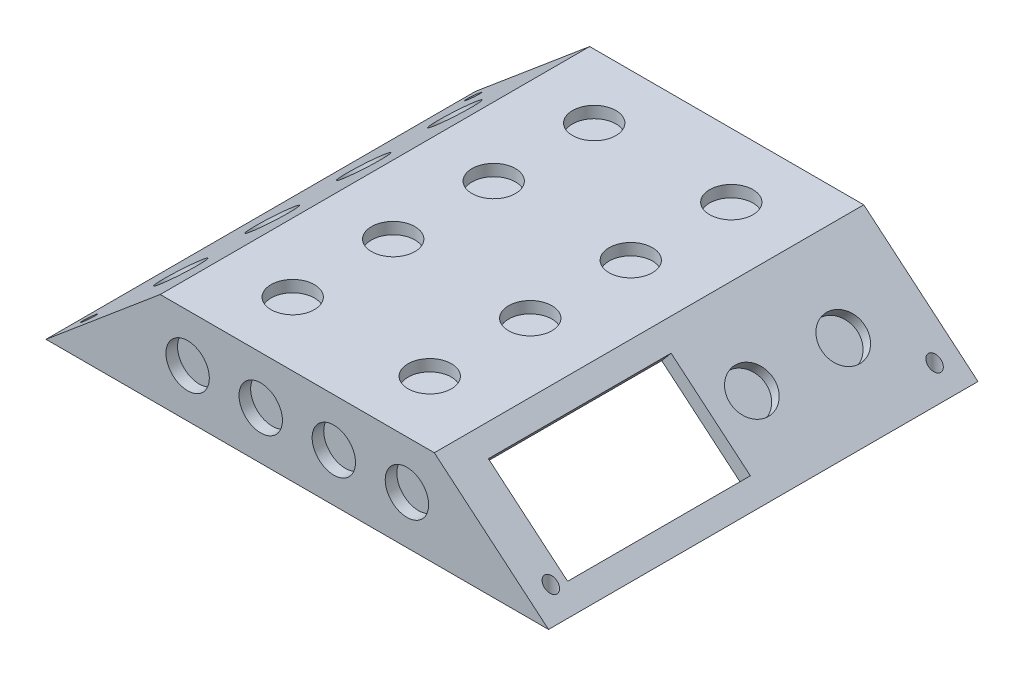
from build123d import *

# Parameters (mm, degrees)
SALIENTE_EXTRUIR1_DEPTH        = 94
CORTAR_EXTRUIR1_DEPTH          = 91
TALADRO_DE_MARGEN_PARA_M2_51_D = 2.7
CORTAR_EXTRUIR2_REACH          = 126.961
CROQUIS12_W                    = 40
CROQUIS12_H                    = 22.649655434
CROQUIS13_R                    = 4.75
CORTAR_EXTRUIR3_DEPTH          = 2.54
CROQUIS14_R                    = 4.75
CORTAR_EXTRUIR4_DEPTH          = 2.54
CROQUIS15_R                    = 4.75
CORTAR_EXTRUIR5_DEPTH          = 2.54
CROQUIS17_R                    = 4.75
CORTAR_EXTRUIR7_DEPTH          = 2.54


with BuildPart() as part:
    # Croquis2 → Saliente-Extruir1 (new body)
    with BuildSketch(Plane.XY):
        Polygon((-30, 21), (-55, 0), (55, 0), (30, 21), align=None)
    extrude(amount=SALIENTE_EXTRUIR1_DEPTH)

    # Croquis3 → Cortar-Extruir1 (cut)
    with BuildSketch(Plane(origin=(0, 0, 0), x_dir=(-1, 0, 0), z_dir=(0, 0, -1))):
        Polygon((-28.834338219, 17.8), (-50.02481441, 0), (50.02481441, 0), (28.834338219, 17.8), align=None)
    extrude(amount=-CORTAR_EXTRUIR1_DEPTH, mode=Mode.SUBTRACT)

    # Taladro de margen para M2.51 (through all)
    with Locations(Plane(origin=(0, 21, 0), x_dir=(1, 0, 0), z_dir=(0, 1, 0))):
        with Locations((-50.5, -5), (50.5, -5), (-50.5, -89), (50.5, -89)):
            Hole(TALADRO_DE_MARGEN_PARA_M2_51_D / 2)

    # Croquis12 → Cortar-Extruir2 (cut, up to next)
    with BuildSketch(Plane(origin=(22.753283302, 27.087242026, 0), x_dir=(0, 0, -1), z_dir=(0.6431920864232734, 0.7657048647896111, 0)), mode=Mode.PRIVATE) as cortar_extruir2_sk1:
        with Locations((-66, -25.788939846)):
            Rectangle(CROQUIS12_W, CROQUIS12_H)
    cortar_extruir2_tool1 = extrude(cortar_extruir2_sk1.sketch, amount=-CORTAR_EXTRUIR2_REACH, mode=Mode.PRIVATE) & part.part
    add(cortar_extruir2_tool1.solids().sort_by_distance((42.5, 10.5, 66))[0], mode=Mode.SUBTRACT)

    # Croquis13 → Cortar-Extruir3 (cut)
    with BuildSketch(Plane(origin=(0, 21, 0), x_dir=(1, 0, 0), z_dir=(0, 1, 0))):
        with Locations((-15, -14)):
            Circle(CROQUIS13_R)
        with Locations((-15, -36)):
            Circle(CROQUIS13_R)
        with Locations((-15, -58)):
            Circle(CROQUIS13_R)
        with Locations((-15, -80)):
            Circle(CROQUIS13_R)
        with Locations((15, -14)):
            Circle(CROQUIS13_R)
        with Locations((15, -36)):
            Circle(CROQUIS13_R)
        with Locations((15, -58)):
            Circle(CROQUIS13_R)
        with Locations((15, -80)):
            Circle(CROQUIS13_R)
    extrude(amount=-CORTAR_EXTRUIR3_DEPTH, mode=Mode.SUBTRACT)

    # Croquis14 → Cortar-Extruir4 (cut)
    with BuildSketch(Plane(origin=(-22.753283302, 27.087242026, 0), x_dir=(0, 0, 1), z_dir=(-0.6431920864232734, 0.7657048647896111, 0))):
        with Locations((17, -25.788939846)):
            Circle(CROQUIS14_R)
        with Locations((37, -25.788939846)):
            Circle(CROQUIS14_R)
        with Locations((57, -25.788939846)):
            Circle(CROQUIS14_R)
        with Locations((77, -25.788939846)):
            Circle(CROQUIS14_R)
    extrude(amount=-CORTAR_EXTRUIR4_DEPTH, mode=Mode.SUBTRACT)

    # Croquis15 → Cortar-Extruir5 (cut)
    with BuildSketch(Plane(origin=(22.753283302, 27.087242026, 0), x_dir=(0, 0, -1), z_dir=(0.6431920864232734, 0.7657048647896111, 0))):
        with Locations((-17, -25.788939846)):
            Circle(CROQUIS15_R)
        with Locations((-37, -25.788939846)):
            Circle(CROQUIS15_R)
    extrude(amount=-CORTAR_EXTRUIR5_DEPTH, mode=Mode.SUBTRACT)

    # Croquis17 → Cortar-Extruir7 (cut)
    with BuildSketch(Plane.XY.offset(94)):
        with Locations((-8, 10.5)):
            Circle(CROQUIS17_R)
        with Locations((8, 10.5)):
            Circle(CROQUIS17_R)
        with Locations((-24, 10.5)):
            Circle(CROQUIS17_R)
        with Locations((24, 10.5)):
            Circle(CROQUIS17_R)
    extrude(amount=-CORTAR_EXTRUIR7_DEPTH, mode=Mode.SUBTRACT)


solid = part.part
